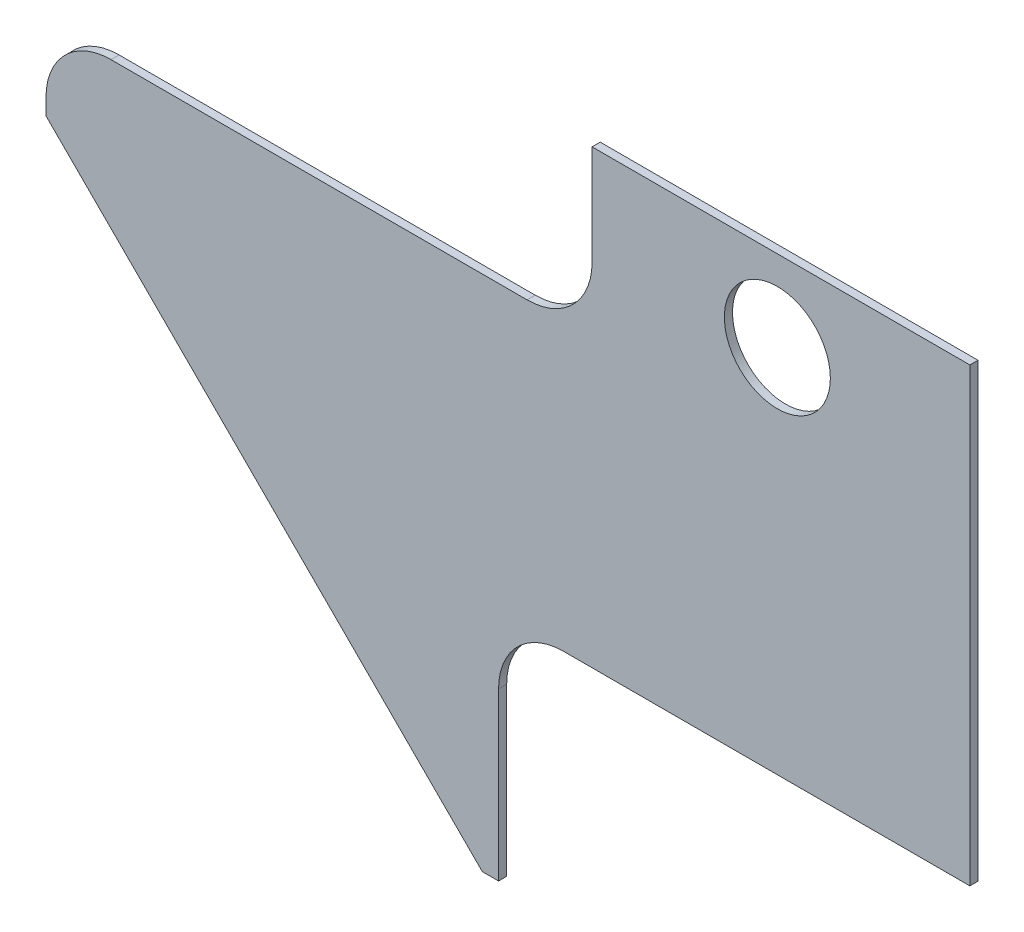
from build123d import *

# Parameters (mm, degrees)
SKETCH1_R           = 20.701
BOSS_EXTRUDE1_DEPTH = 3.175
SKETCH2_W           = 184.15
SKETCH2_H           = 90.42146
CUT_EXTRUDE1_DEPTH  = 266.893552722
FILLET1_R           = 25.4
SKETCH4_W           = 213.36
SKETCH4_H           = 64.479988722
CUT_EXTRUDE2_DEPTH  = 266.893552722
FILLET2_R           = 25.4


with BuildPart() as part:
    # Sketch1 → Boss-Extrude1 (new body)
    with BuildSketch(Plane.XY):
        Polygon((-138.259383474, 48.991487021), (32.210627804, -121.478524257), (222.710627804, -121.478524257), (222.710627804, 145.221475743), (-138.259383474, 145.221475743), align=None)
        with Locations((147.490616526, 113.471475743)):
            Circle(SKETCH1_R, mode=Mode.SUBTRACT)
    extrude(amount=BOSS_EXTRUDE1_DEPTH)

    # Sketch2 → Cut-Extrude1 (cut, through all)
    with BuildSketch(Plane.XY.offset(3.175)):
        with Locations((130.635627804, -76.267794257)):
            Rectangle(SKETCH2_W, SKETCH2_H)
    extrude(amount=-CUT_EXTRUDE1_DEPTH, mode=Mode.SUBTRACT)

    # Fillet1
    fillet1_edges = [part.edges().sort_by_distance(p)[0] for p in [
        (38.560627804, -31.057064257, 1.5875),
    ]]
    fillet(fillet1_edges, radius=FILLET1_R)

    # Sketch4 → Cut-Extrude2 (cut, through all)
    with BuildSketch(Plane.XY.offset(3.175)):
        with Locations((-31.579383474, 112.981481382)):
            Rectangle(SKETCH4_W, SKETCH4_H)
    extrude(amount=-CUT_EXTRUDE2_DEPTH, mode=Mode.SUBTRACT)

    # Fillet2
    fillet2_edges = [part.edges().sort_by_distance(p)[0] for p in [
        (-138.259383474, 80.741487021, 1.5875),
        (75.100616526, 80.741487021, 1.5875),
    ]]
    fillet(fillet2_edges, radius=FILLET2_R)


solid = part.part
